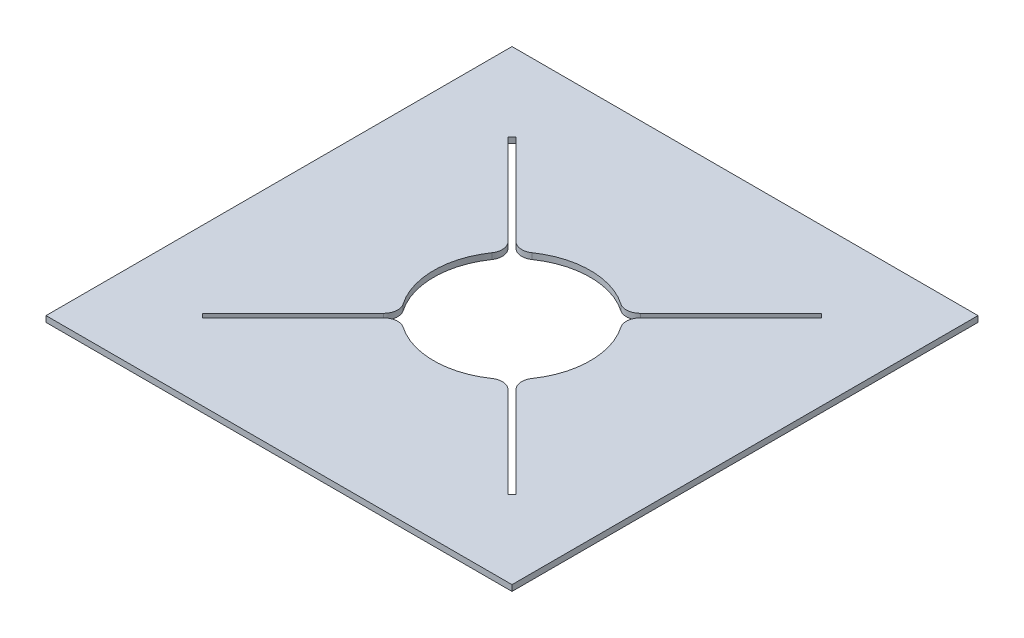
from build123d import *

# Parameters (mm, degrees)
SKETCH1_W           = 500
SKETCH1_H           = 500
BOSS_EXTRUDE1_DEPTH = 6.35
SKETCH2_R           = 84
CUT_EXTRUDE1_DEPTH  = 6.35
CUT_EXTRUDE3_DEPTH  = 6.35
FILLET1_R           = 15


with BuildPart() as part:
    # Sketch1 → Boss-Extrude1 (new body)
    with BuildSketch(Plane(origin=(0, 0, 0), x_dir=(1, 0, 0), z_dir=(0, 1, 0))):
        with Locations((48.037604912, -85.456276451)):
            Rectangle(SKETCH1_W, SKETCH1_H)
    extrude(amount=BOSS_EXTRUDE1_DEPTH)

    # Sketch2 → Cut-Extrude1 (cut)
    with BuildSketch(Plane(origin=(0, 6.35, 0), x_dir=(1, 0, 0), z_dir=(0, 1, 0))):
        with Locations((48.037604912, -85.456276451)):
            Circle(SKETCH2_R)
    extrude(amount=-CUT_EXTRUDE1_DEPTH, mode=Mode.SUBTRACT)

    # Sketch3 → Cut-Extrude3 (cut)
    with BuildSketch(Plane(origin=(0, 6.35, 0), x_dir=(1, 0, 0), z_dir=(0, 1, 0))):
        Polygon((216.329018834, 78.592496784), (103.191933845, -34.544588206), (98.949293158, -30.301947519), (212.086378147, 82.835137471), align=None)
        Polygon((-120.25380901, 78.592496784), (-116.011168323, 82.835137471), (-2.874083333, -30.301947519), (-7.11672402, -34.544588206), align=None)
        Polygon((212.086378147, -253.747690374), (98.949293158, -140.610605384), (103.191933845, -136.367964697), (216.329018835, -249.505049687), align=None)
        Polygon((-120.25380901, -249.505049687), (-7.11672402, -136.367964697), (-2.874083333, -140.610605384), (-116.011168323, -253.747690374), align=None)
    extrude(amount=-CUT_EXTRUDE3_DEPTH, mode=Mode.SUBTRACT)

    # Fillet1
    fillet1_edges = [part.edges().sort_by_distance(p)[0] for p in [
        (105.275361381, 3.175, 23.975879296),
        (109.518002068, 3.175, 28.218519983),
        (109.518002068, 3.175, 142.69403292),
        (105.275361381, 3.175, 146.936673607),
        (-9.200151557, 3.175, 146.936673607),
        (-13.442792244, 3.175, 142.69403292),
        (-13.442792244, 3.175, 28.218519983),
        (-9.200151557, 3.175, 23.975879296),
    ]]
    fillet(fillet1_edges, radius=FILLET1_R)


solid = part.part
